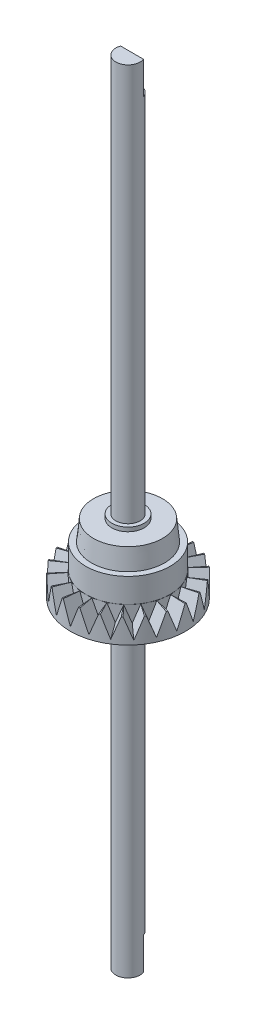
from build123d import *

# Parameters (mm, degrees)
SKETCH2_R           = 1.5
BOSS_EXTRUDE1_DEPTH = 37.5
SKETCH3_R           = 2.5
BOSS_EXTRUDE2_DEPTH = 2
SKETCH4_R           = 7.1
BOSS_EXTRUDE3_DEPTH = 3
SKETCH5_R           = 5.2
BOSS_EXTRUDE4_DEPTH = 3
SKETCH6_R           = 4.5
SKETCH7_R           = 4.25
SKETCH8_R           = 2
BOSS_EXTRUDE5_DEPTH = 0.5
SKETCH9_R           = 1.5
BOSS_EXTRUDE6_DEPTH = 49
CUT_EXTRUDE1_DEPTH  = 4
CUT_EXTRUDE2_START  = -4
CUT_EXTRUDE2_DEPTH  = 4
CIRPATTERN2_COUNT   = 22


with BuildPart() as part:
    # Sketch2 → Boss-Extrude1 (new body)
    with BuildSketch(Plane(origin=(0, 0, 0), x_dir=(1, 0, 0), z_dir=(0, 1, 0))):
        Circle(SKETCH2_R)
    extrude(amount=BOSS_EXTRUDE1_DEPTH)

    # Sketch10 → Cut-Extrude1 (cut)
    with BuildSketch(Plane(origin=(0, 0, 0), x_dir=(1, 0, 0), z_dir=(0, 1, 0))):
        with BuildLine():
            Line((-1.414213562, 0.5), (1.414213562, 0.5))
            ThreePointArc((1.414213562, 0.5), (0, 1.5), (-1.414213562, 0.5))
        make_face()
    extrude(amount=CUT_EXTRUDE1_DEPTH, mode=Mode.SUBTRACT)


with BuildPart() as body_2:
    # Sketch3 → Boss-Extrude2 (new body)
    with BuildSketch(Plane(origin=(0, 37.5, 0), x_dir=(1, 0, 0), z_dir=(0, 1, 0))):
        Circle(SKETCH3_R)
    extrude(amount=BOSS_EXTRUDE2_DEPTH)

    # Sketch4 → Boss-Extrude3 (add)
    with BuildSketch(Plane(origin=(0, 39.5, 0), x_dir=(1, 0, 0), z_dir=(0, 1, 0))):
        Circle(SKETCH4_R)
    extrude(amount=BOSS_EXTRUDE3_DEPTH)

    # Sketch12 → Cut-Loft8 section 0
    with BuildSketch(Plane.XY.offset(7.1)):
        with BuildLine():
            Line((0, 40), (-0.75, 42))
            Line((-0.75, 42), (-0.9375, 42.5))
            Line((-0.9375, 42.5), (0.9375, 42.5))
            Line((0.9375, 42.5), (0.75, 42))
            Line((0.75, 42), (0, 40))
        make_face()
    # Sketch13 → Cut-Loft8 section 1
    with BuildSketch(Plane.XY.offset(5.2)):
        with BuildLine():
            Line((0, 40.5), (-0.75, 42.5))
            Line((-0.75, 42.5), (0.75, 42.5))
            Line((0.75, 42.5), (0, 40.5))
        make_face()
    cut_loft8 = loft(mode=Mode.SUBTRACT)

    # CirPattern2: Cut-Loft8 ×22 about axis
    cirpattern2_axis = Axis((0, 42.5, 0), (0, -1, 0))
    for i in range(1, CIRPATTERN2_COUNT):
        add(cut_loft8.rotate(cirpattern2_axis, i * 360 / CIRPATTERN2_COUNT), mode=Mode.SUBTRACT)


with BuildPart() as body_3:
    # Sketch5 → Boss-Extrude4 (new body)
    with BuildSketch(Plane(origin=(0, 42.5, 0), x_dir=(1, 0, 0), z_dir=(0, 1, 0))):
        Circle(SKETCH5_R)
    extrude(amount=BOSS_EXTRUDE4_DEPTH)

    # Sketch6 → Loft1 section 0
    with BuildSketch(Plane(origin=(0, 45.5, 0), x_dir=(1, 0, 0), z_dir=(0, 1, 0))):
        Circle(SKETCH6_R)
    # Sketch7 → Loft1 section 1
    with BuildSketch(Plane(origin=(0, 48, 0), x_dir=(1, 0, 0), z_dir=(0, 1, 0))):
        Circle(SKETCH7_R)
    loft()

    # Sketch8 → Boss-Extrude5 (add)
    with BuildSketch(Plane(origin=(0, 48, 0), x_dir=(1, 0, 0), z_dir=(0, 1, 0))):
        Circle(SKETCH8_R)
    extrude(amount=BOSS_EXTRUDE5_DEPTH)


with BuildPart() as body_4:
    # Sketch9 → Boss-Extrude6 (new body)
    with BuildSketch(Plane(origin=(0, 48.5, 0), x_dir=(1, 0, 0), z_dir=(0, 1, 0))):
        Circle(SKETCH9_R)
    extrude(amount=BOSS_EXTRUDE6_DEPTH)

    # Sketch11 → Cut-Extrude2 (cut)
    with BuildSketch(Plane(origin=(0, 97.5, 0), x_dir=(1, 0, 0), z_dir=(0, 1, 0)).offset(CUT_EXTRUDE2_START)):
        with BuildLine():
            Line((-1.414213562, 0.5), (1.414213562, 0.5))
            ThreePointArc((1.414213562, 0.5), (0, 1.5), (-1.414213562, 0.5))
        make_face()
    extrude(amount=CUT_EXTRUDE2_DEPTH, mode=Mode.SUBTRACT)


solid = Compound([part.part, body_2.part, body_3.part, body_4.part])
